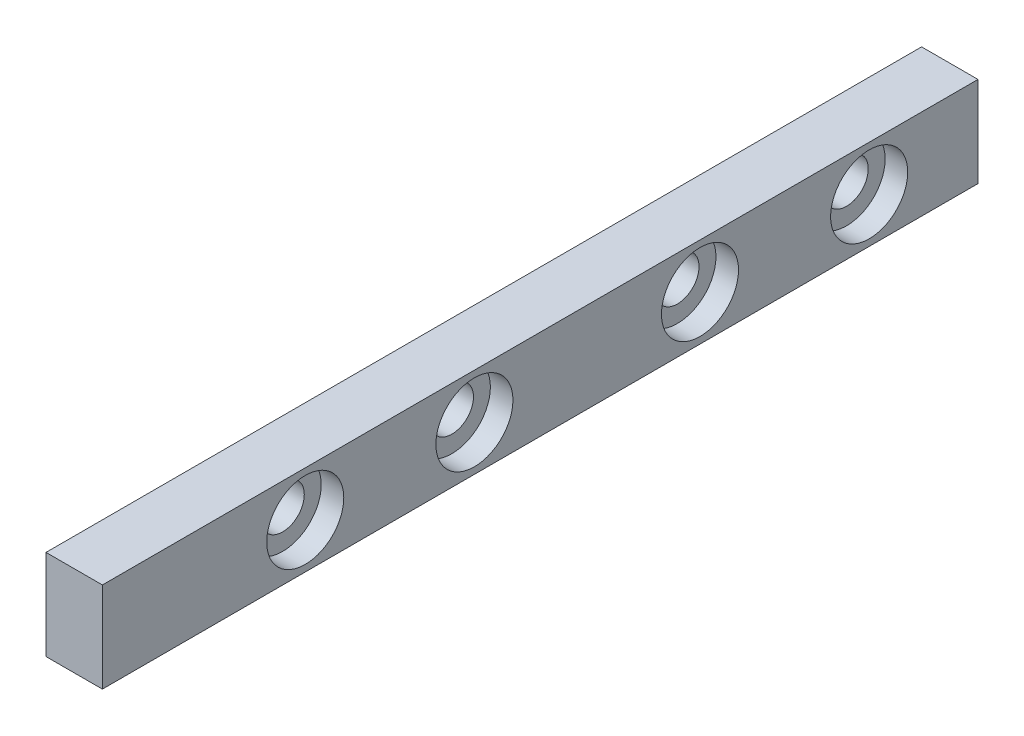
from build123d import *

# Parameters (mm, degrees)
SKETCH_1_W          = 41.58
SKETCH_1_H          = 4.8
SKETCH_1_R          = 1.15
EXTRUDE_1_DEPTH     = 3
SKETCH_2_R          = 2.05
CUT_EXTRUDE_1_DEPTH = 1.2
SKETCH_3_W          = 3
SKETCH_3_H          = 4.8
EXTRUDE_2_DEPTH     = 5


with BuildPart() as part:
    # 草图1 → 凸台-拉伸1 (new body)
    with BuildSketch(Plane(origin=(0, 0, 0), x_dir=(0, 0, -1), z_dir=(1, 0, 0))):
        with Locations((20.79, 2.4)):
            Rectangle(SKETCH_1_W, SKETCH_1_H)
        with Locations((14.79, 2.4)):
            Circle(SKETCH_1_R, mode=Mode.SUBTRACT)
        with Locations((5.79, 2.4)):
            Circle(SKETCH_1_R, mode=Mode.SUBTRACT)
        with Locations((26.79, 2.4)):
            Circle(SKETCH_1_R, mode=Mode.SUBTRACT)
        with Locations((35.79, 2.4)):
            Circle(SKETCH_1_R, mode=Mode.SUBTRACT)
    extrude(amount=EXTRUDE_1_DEPTH)

    # 草图2 → 切除-拉伸1 (cut)
    with BuildSketch(Plane(origin=(3, 0, 0), x_dir=(0, 0, -1), z_dir=(1, 0, 0))):
        with Locations((5.79, 2.4)):
            Circle(SKETCH_2_R)
        with Locations((14.79, 2.4)):
            Circle(SKETCH_2_R)
        with Locations((26.79, 2.4)):
            Circle(SKETCH_2_R)
        with Locations((35.79, 2.4)):
            Circle(SKETCH_2_R)
    extrude(amount=-CUT_EXTRUDE_1_DEPTH, mode=Mode.SUBTRACT)

    # 草图3 → 凸台-拉伸2 (add)
    with BuildSketch(Plane.XY):
        with Locations((1.5, 2.4)):
            Rectangle(SKETCH_3_W, SKETCH_3_H)
    extrude(amount=EXTRUDE_2_DEPTH)


solid = part.part
